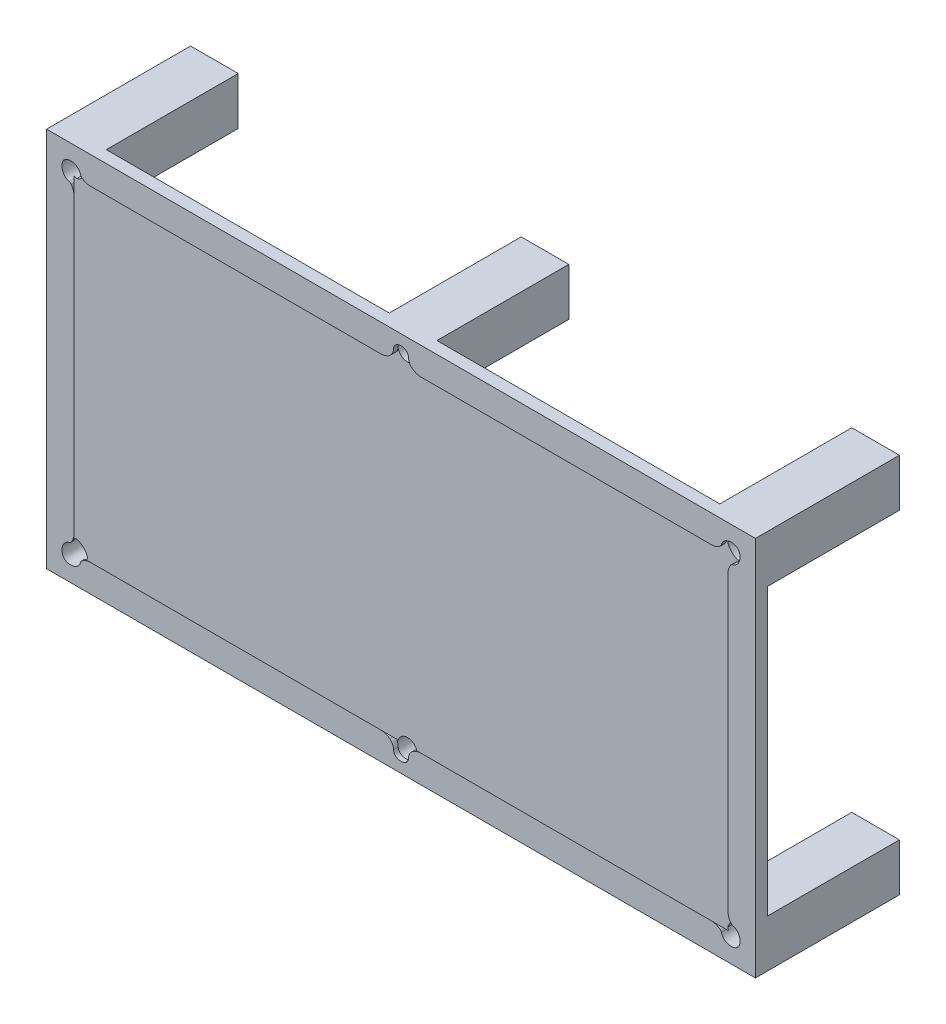
from build123d import *
from build123d.topology import SkipClean

# Parameters (mm, degrees)
SZKIC1_W                        = 3869
SZKIC1_H                        = 2078
SZKIC1_W_2                      = 3569
SZKIC1_H_2                      = 1778
DODANIE_WYCI_GNI_CIE1_DEPTH     = 36
SFAZOWANIE1_SIZE                = 36
SZKIC3_W                        = 3869
SZKIC3_H                        = 2078
DODANIE_WYCI_GNI_CIE3_DEPTH     = 30
SZKIC5_W                        = 260
SZKIC5_H                        = 260
DODANIE_WYCI_GNI_CIE4_DEPTH     = 720
WYTNIJ_WYCI_GNI_CIE1_DEPTH      = 35
WYTNIJ_WYCI_GNI_CIE2_START      = -652
WYTNIJ_WYCI_GNI_CIE2_DEPTH      = 652
ZAOKR_GLENIE1_R                 = 20
WYTNIJ_WYCI_GNI_CIE3_DEPTH      = 35
WYTNIJ_WYCI_GNI_CIE4_DEPTH      = 10
WYTNIJ_WYCI_GNI_CIE4_DEPTH_BACK = 594
SZKIC11_R                       = 53.19
WYTNIJ_WYCI_GNI_CIE5_DEPTH      = 511
DODANIE_WYCI_GNI_CIE5_START     = 720
DODANIE_WYCI_GNI_CIE5_DEPTH     = 720


# Read off the part's stored shape, not the designer's step: Wytnij-wyciągnięcie2
with BuildPart() as part:
    # Szkic1 → Dodanie-wyciągnięcie1 (new body)
    with BuildSketch(Plane.XY):
        Rectangle(SZKIC1_W, SZKIC1_H)
        Rectangle(SZKIC1_W_2, SZKIC1_H_2, mode=Mode.SUBTRACT)
    extrude(amount=DODANIE_WYCI_GNI_CIE1_DEPTH)

    # Sfazowanie1
    sfazowanie1_edges = [part.edges().sort_by_distance(p)[0] for p in [
        (-1784.5, 0, 0),
        (0, -889, 0),
        (1784.5, 0, 0),
        (0, 889, 0),
    ]]
    chamfer(sfazowanie1_edges, length=SFAZOWANIE1_SIZE - 0.0001)  # a hair under: the kernel refuses the full size

    # Szkic3 → Dodanie-wyciągnięcie3 (add)
    with BuildSketch(Plane(origin=(0, 0, 0), x_dir=(-1, 0, 0), z_dir=(0, 0, -1))):
        Rectangle(SZKIC3_W, SZKIC3_H)
    extrude(amount=DODANIE_WYCI_GNI_CIE3_DEPTH)

    # Szkic5 → Dodanie-wyciągnięcie4 (add)
    with BuildSketch(Plane(origin=(0, 0, -30), x_dir=(-1, 0, 0), z_dir=(0, 0, -1))):
        with Locations((-1804.5, 909)):
            Rectangle(SZKIC5_W, SZKIC5_H)
        with Locations((1804.5, 909)):
            Rectangle(SZKIC5_W, SZKIC5_H)
        with Locations((1804.5, -909)):
            Rectangle(SZKIC5_W, SZKIC5_H)
        with Locations((-1804.5, -909)):
            Rectangle(SZKIC5_W, SZKIC5_H)
    extrude(amount=DODANIE_WYCI_GNI_CIE4_DEPTH)

    # Szkic6 → Wytnij-wyciągnięcie1 (cut)
    with BuildSketch(Plane.XY.offset(36)):
        with BuildLine():
            Line((-1730.699930173, -898.305119808), (-1735.775702356, -889))
            Line((-1735.775702356, -889), (-1757.066073244, -889))
            ThreePointArc((-1757.066073244, -889), (-1751.617811819, -898.93387879), (-1747.477245282, -909.480025439))
            ThreePointArc((-1747.477245282, -909.480025439), (-1739.335219817, -903.522294393), (-1730.699930173, -898.305119808))
        make_face()
        with BuildLine():
            ThreePointArc((-1730.699930173, -898.305119808), (-1713.038835988, -891.362916259), (-1694.21, -889))
            Line((-1694.21, -889), (-1735.775702356, -889))
            Line((-1735.775702356, -889), (-1730.699930173, -898.305119808))
        make_face()
        with BuildLine():
            ThreePointArc((-1804.980025439, -851.977245282), (-1794.43387879, -856.117811819), (-1784.5, -861.566073244))
            Line((-1784.5, -861.566073244), (-1784.5, -840.275702356))
            Line((-1784.5, -840.275702356), (-1793.805119808, -835.199930173))
            ThreePointArc((-1793.805119808, -835.199930173), (-1799.022294393, -843.835219817), (-1804.980025439, -851.977245282))
        make_face()
        with BuildLine():
            Line((-1793.805119808, -835.199930173), (-1784.5, -840.275702356))
            Line((-1784.5, -840.275702356), (-1784.5, -798.71))
            ThreePointArc((-1784.5, -798.71), (-1786.862916259, -817.538835988), (-1793.805119808, -835.199930173))
        make_face()
        with BuildLine():
            ThreePointArc((-1747.477245282, 909.480025439), (-1751.617811819, 898.93387879), (-1757.066073244, 889))
            Line((-1757.066073244, 889), (-1735.775702356, 889))
            Line((-1735.775702356, 889), (-1730.699930173, 898.305119808))
            ThreePointArc((-1730.699930173, 898.305119808), (-1739.335219817, 903.522294393), (-1747.477245282, 909.480025439))
        make_face()
        with BuildLine():
            Line((-1730.699930173, 898.305119808), (-1735.775702356, 889))
            Line((-1735.775702356, 889), (-1694.21, 889))
            ThreePointArc((-1694.21, 889), (-1713.038835988, 891.362916259), (-1730.699930173, 898.305119808))
        make_face()
        with BuildLine():
            ThreePointArc((-1793.805119808, 835.199930173), (-1786.862916259, 817.538835988), (-1784.5, 798.71))
            Line((-1784.5, 798.71), (-1784.5, 840.275702356))
            Line((-1784.5, 840.275702356), (-1793.805119808, 835.199930173))
        make_face()
        with BuildLine():
            Line((-1793.805119808, 835.199930173), (-1784.5, 840.275702356))
            Line((-1784.5, 840.275702356), (-1784.5, 861.566073244))
            ThreePointArc((-1784.5, 861.566073244), (-1794.43387879, 856.117811819), (-1804.980025439, 851.977245282))
            ThreePointArc((-1804.980025439, 851.977245282), (-1799.022294393, 843.835219817), (-1793.805119808, 835.199930173))
        make_face()
        with BuildLine():
            Line((1694.21, 889), (1735.775702356, 889))
            Line((1735.775702356, 889), (1730.699930173, 898.305119808))
            ThreePointArc((1730.699930173, 898.305119808), (1713.038835988, 891.362916259), (1694.21, 889))
        make_face()
        with BuildLine():
            Line((1735.775702356, 889), (1757.066073244, 889))
            ThreePointArc((1757.066073244, 889), (1751.617811819, 898.93387879), (1747.477245282, 909.480025439))
            ThreePointArc((1747.477245282, 909.480025439), (1739.335219817, 903.522294393), (1730.699930173, 898.305119808))
            Line((1730.699930173, 898.305119808), (1735.775702356, 889))
        make_face()
        with BuildLine():
            Line((1784.5, 861.566073244), (1784.5, 840.275702356))
            Line((1784.5, 840.275702356), (1793.805119808, 835.199930173))
            ThreePointArc((1793.805119808, 835.199930173), (1799.022294393, 843.835219817), (1804.980025439, 851.977245282))
            ThreePointArc((1804.980025439, 851.977245282), (1794.43387879, 856.117811819), (1784.5, 861.566073244))
        make_face()
        with BuildLine():
            Line((1784.5, 840.275702356), (1784.5, 798.71))
            ThreePointArc((1784.5, 798.71), (1786.862916259, 817.538835988), (1793.805119808, 835.199930173))
            Line((1793.805119808, 835.199930173), (1784.5, 840.275702356))
        make_face()
        with BuildLine():
            Line((1735.775702356, -889), (1694.21, -889))
            ThreePointArc((1694.21, -889), (1713.038835988, -891.362916259), (1730.699930173, -898.305119808))
            Line((1730.699930173, -898.305119808), (1735.775702356, -889))
        make_face()
        with BuildLine():
            Line((1757.066073244, -889), (1735.775702356, -889))
            Line((1735.775702356, -889), (1730.699930173, -898.305119808))
            ThreePointArc((1730.699930173, -898.305119808), (1739.335219817, -903.522294393), (1747.477245282, -909.480025439))
            ThreePointArc((1747.477245282, -909.480025439), (1751.617811819, -898.93387879), (1757.066073244, -889))
        make_face()
        with BuildLine():
            Line((1784.5, -840.275702356), (1784.5, -861.566073244))
            ThreePointArc((1784.5, -861.566073244), (1794.43387879, -856.117811819), (1804.980025439, -851.977245282))
            ThreePointArc((1804.980025439, -851.977245282), (1799.022294393, -843.835219817), (1793.805119808, -835.199930173))
            Line((1793.805119808, -835.199930173), (1784.5, -840.275702356))
        make_face()
        with BuildLine():
            Line((1784.5, -798.71), (1784.5, -840.275702356))
            Line((1784.5, -840.275702356), (1793.805119808, -835.199930173))
            ThreePointArc((1793.805119808, -835.199930173), (1786.862916259, -817.538835988), (1784.5, -798.71))
        make_face()
    extrude(amount=-WYTNIJ_WYCI_GNI_CIE1_DEPTH, mode=Mode.SUBTRACT)

    # Wytnij-wyciągnięcie2 outline → Wytnij-wyciągnięcie2 (cut)
    with BuildSketch(Plane.XY.offset(36).offset(WYTNIJ_WYCI_GNI_CIE2_START)):
        with BuildLine():
            add(Edge.make_bspline(
                [(-1804.980025439, 851.977245282), (-1851.807541301, 858.242170001), (-1873.141506019, 977.641506019), (-1753.742170001, 956.307541301), (-1747.477245282, 909.480025439)],
                knots=[0, 0, 0, 0, 0.5, 1, 1, 1, 1], degree=3))
            ThreePointArc((-1804.980025439, 851.977245282), (-1794.43387879, 856.117811819), (-1784.5, 861.566073244))
            add(Edge.make_bspline(
                [(-1784.5, 861.566073244), (-1773.547324001, 868.583765228), (-1764.083765228, 878.047324001), (-1757.066073244, 889)],
                knots=[0.269130869, 0.269130869, 0.269130869, 0.269130869, 0.730869131, 0.730869131, 0.730869131, 0.730869131], degree=3))
            ThreePointArc((-1757.066073244, 889), (-1751.617811819, 898.93387879), (-1747.477245282, 909.480025439))
        make_face()
        with BuildLine():
            add(Edge.make_bspline(
                [(-1804.980025439, -851.977245282), (-1851.807541301, -858.242170001), (-1873.141506019, -977.641506019), (-1753.742170001, -956.307541301), (-1747.477245282, -909.480025439)],
                knots=[0, 0, 0, 0, 0.5, 1, 1, 1, 1], degree=3))
            add(Edge.make_bspline(
                [(-1747.477245282, -909.480025439), (-1755.796755668, -882.703934402), (-1778.203934402, -860.296755668), (-1804.980025439, -851.977245282)],
                knots=[0.730869131, 0.730869131, 0.730869131, 0.730869131, 1.730869131, 1.730869131, 1.730869131, 1.730869131], degree=3))
        make_face()
        with BuildLine():
            add(Edge.make_bspline(
                [(1804.980025439, -851.977245282), (1851.807541301, -858.242170001), (1873.141506019, -977.641506019), (1753.742170001, -956.307541301), (1747.477245282, -909.480025439)],
                knots=[0, 0, 0, 0, 0.5, 1, 1, 1, 1], degree=3))
            ThreePointArc((1804.980025439, -851.977245282), (1794.43387879, -856.117811819), (1784.5, -861.566073244))
            add(Edge.make_bspline(
                [(1784.5, -861.566073244), (1773.547324001, -868.583765228), (1764.083765228, -878.047324001), (1757.066073244, -889)],
                knots=[0.269130869, 0.269130869, 0.269130869, 0.269130869, 0.730869131, 0.730869131, 0.730869131, 0.730869131], degree=3))
            ThreePointArc((1757.066073244, -889), (1751.617811819, -898.93387879), (1747.477245282, -909.480025439))
        make_face()
        with BuildLine():
            add(Edge.make_bspline(
                [(1804.980025439, 851.977245282), (1851.807541301, 858.242170001), (1873.141506019, 977.641506019), (1753.742170001, 956.307541301), (1747.477245282, 909.480025439)],
                knots=[0, 0, 0, 0, 0.5, 1, 1, 1, 1], degree=3))
            add(Edge.make_bspline(
                [(1747.477245282, 909.480025439), (1755.796755668, 882.703934402), (1778.203934402, 860.296755668), (1804.980025439, 851.977245282)],
                knots=[0.730869131, 0.730869131, 0.730869131, 0.730869131, 1.730869131, 1.730869131, 1.730869131, 1.730869131], degree=3))
        make_face()
    extrude(amount=WYTNIJ_WYCI_GNI_CIE2_DEPTH, mode=Mode.SUBTRACT)

    # Zaokrąglenie1
    zaokr_glenie1_edges = [part.edges().sort_by_distance(p)[0] for p in [
        (-1804.980025439, 851.977245282, 25.75993728),
        (-1747.477245282, 909.480025439, 25.75993728),
        (-1804.980025439, -851.977245282, 25.75993728),
        (-1747.477245282, -909.480025439, 25.75993728),
        (1747.477245282, -909.480025439, 25.75993728),
        (1804.980025439, -851.977245282, 25.75993728),
        (1804.980025439, 851.977245282, 25.75993728),
        (1747.477245282, 909.480025439, 25.75993728),
    ]]
    fillet(zaokr_glenie1_edges, radius=ZAOKR_GLENIE1_R)

    # Szkic8 → Wytnij-wyciągnięcie3 (cut)
    with BuildSketch(Plane.XY.offset(36)):
        with BuildLine():
            ThreePointArc((-43.031613931, -909.545702431), (-29.388461869, -896.476103161), (-12.037441589, -889))
            Line((-12.037441589, -889), (-110.34, -889))
            ThreePointArc((-110.34, -889), (-84.719347685, -893.241564094), (-61.832573079, -905.513655976))
            ThreePointArc((-61.832573079, -905.513655976), (-55.109242933, -911.672624899), (-49.53, -918.884290086))
            Line((-49.53, -918.884290086), (-43.031613931, -909.545702431))
        make_face()
        with BuildLine():
            Line((0, -940.81), (0, -889))
            Line((0, -889), (-12.037441589, -889))
            ThreePointArc((-12.037441589, -889), (-29.388461869, -896.476103161), (-43.031613931, -909.545702431))
            Line((-43.031613931, -909.545702431), (0, -940.81))
        make_face()
        with BuildLine():
            ThreePointArc((43.031613931, -909.545702431), (29.388461869, -896.476103161), (12.037441589, -889))
            Line((12.037441589, -889), (0, -889))
            Line((0, -889), (0, -940.81))
            Line((0, -940.81), (43.031613931, -909.545702431))
        make_face()
        with BuildLine():
            ThreePointArc((61.832573079, -905.513655976), (84.719347685, -893.241564094), (110.34, -889))
            Line((110.34, -889), (12.037441589, -889))
            ThreePointArc((12.037441589, -889), (29.388461869, -896.476103161), (43.031613931, -909.545702431))
            Line((43.031613931, -909.545702431), (49.53, -918.884290086))
            ThreePointArc((49.53, -918.884290086), (55.109242933, -911.672624899), (61.832573079, -905.513655976))
        make_face()
        with BuildLine():
            Line((49.53, -918.884290086), (43.031613931, -909.545702431))
            Line((43.031613931, -909.545702431), (0, -940.81))
            Line((0, -940.81), (-43.031613931, -909.545702431))
            Line((-43.031613931, -909.545702431), (-49.53, -918.884290086))
            ThreePointArc((-49.53, -918.884290086), (-43.166542194, -932.765858286), (-40.986117651, -947.88))
            Line((-40.986117651, -947.88), (40.986117651, -947.88))
            ThreePointArc((40.986117651, -947.88), (43.166542194, -932.765858286), (49.53, -918.884290086))
        make_face()
        with BuildLine():
            Line((-110.34, 889), (-12.037441589, 889))
            ThreePointArc((-12.037441589, 889), (-29.388461869, 896.476103161), (-43.031613931, 909.545702431))
            Line((-43.031613931, 909.545702431), (-49.53, 918.884290086))
            ThreePointArc((-49.53, 918.884290086), (-55.109242933, 911.672624899), (-61.832573079, 905.513655976))
            ThreePointArc((-61.832573079, 905.513655976), (-84.719347685, 893.241564094), (-110.34, 889))
        make_face()
        with BuildLine():
            Line((0, 940.81), (43.031613931, 909.545702431))
            Line((43.031613931, 909.545702431), (49.53, 918.884290086))
            ThreePointArc((49.53, 918.884290086), (43.166542194, 932.765858286), (40.986117651, 947.88))
            Line((40.986117651, 947.88), (-40.986117651, 947.88))
            ThreePointArc((-40.986117651, 947.88), (-43.166542194, 932.765858286), (-49.53, 918.884290086))
            Line((-49.53, 918.884290086), (-43.031613931, 909.545702431))
            Line((-43.031613931, 909.545702431), (0, 940.81))
        make_face()
        with BuildLine():
            Line((-12.037441589, 889), (0, 889))
            Line((0, 889), (0, 940.81))
            Line((0, 940.81), (-43.031613931, 909.545702431))
            ThreePointArc((-43.031613931, 909.545702431), (-29.388461869, 896.476103161), (-12.037441589, 889))
        make_face()
        with BuildLine():
            Line((0, 889), (12.037441589, 889))
            ThreePointArc((12.037441589, 889), (29.388461869, 896.476103161), (43.031613931, 909.545702431))
            Line((43.031613931, 909.545702431), (0, 940.81))
            Line((0, 940.81), (0, 889))
        make_face()
        with BuildLine():
            Line((12.037441589, 889), (110.34, 889))
            ThreePointArc((110.34, 889), (84.719347685, 893.241564094), (61.832573079, 905.513655976))
            ThreePointArc((61.832573079, 905.513655976), (55.109242933, 911.672624899), (49.53, 918.884290086))
            Line((49.53, 918.884290086), (43.031613931, 909.545702431))
            ThreePointArc((43.031613931, 909.545702431), (29.388461869, 896.476103161), (12.037441589, 889))
        make_face()
    extrude(amount=-WYTNIJ_WYCI_GNI_CIE3_DEPTH, mode=Mode.SUBTRACT)

    # Szkic11 → Wytnij-wyciągnięcie4 (cut, two sides: drawn at the far end of the back side and taken through both)
    with BuildSketch(Plane.XY.offset(-WYTNIJ_WYCI_GNI_CIE4_DEPTH_BACK)):
        with Locations(Location((0, -940.81, 0), (0, 0, 162.70831437))):
            Circle(SZKIC11_R)
        with Locations(Location((0, 940.81, 0), (0, 0, 197.29168563))):
            Circle(SZKIC11_R)
    extrude(amount=WYTNIJ_WYCI_GNI_CIE4_DEPTH + WYTNIJ_WYCI_GNI_CIE4_DEPTH_BACK, mode=Mode.SUBTRACT)

    # Szkic12 → Wytnij-wyciągnięcie5 (cut)
    with BuildSketch(Plane.XY.offset(36)):
        with BuildLine():
            add(Edge.make_bspline(
                [(-40.986117651, 947.88), (-40.011349902, 962.578981992), (-31.594207563, 972.578981992), (-20.493058826, 977.88)],
                knots=[0, 0, 0, 0, 0.319680778, 0.319680778, 0.319680778, 0.319680778], degree=3))
            Line((-40.986117651, 947.88), (-20.493058826, 947.88))
            Line((-20.493058826, 947.88), (-20.493058826, 977.88))
        make_face()
        with BuildLine():
            Line((-20.493058826, 977.88), (-20.493058826, 947.88))
            Line((-20.493058826, 947.88), (0, 947.88))
            Line((0, 947.88), (20.493058826, 947.88))
            Line((20.493058826, 947.88), (20.493058826, 977.88))
            add(Edge.make_bspline(
                [(-20.493058826, 977.88), (-7.969625141, 983.860187191), (7.969625141, 983.860187191), (20.493058826, 977.88)],
                knots=[0.319680778, 0.319680778, 0.319680778, 0.319680778, 0.680319222, 0.680319222, 0.680319222, 0.680319222], degree=3))
        make_face()
        with BuildLine():
            add(Edge.make_bspline(
                [(20.493058826, 977.88), (31.594207563, 972.578981992), (40.011349902, 962.578981992), (40.986117651, 947.88)],
                knots=[0.680319222, 0.680319222, 0.680319222, 0.680319222, 1, 1, 1, 1], degree=3))
            Line((20.493058826, 977.88), (20.493058826, 947.88))
            Line((20.493058826, 947.88), (40.986117651, 947.88))
        make_face()
        with BuildLine():
            add(Edge.make_bspline(
                [(-40.986117651, -947.88), (-40.011349902, -962.578981992), (-31.594207563, -972.578981992), (-20.493058826, -977.88)],
                knots=[0, 0, 0, 0, 0.319680778, 0.319680778, 0.319680778, 0.319680778], degree=3))
            Line((-20.493058826, -977.88), (-20.493058826, -947.88))
            Line((-20.493058826, -947.88), (-40.986117651, -947.88))
        make_face()
        with BuildLine():
            Line((20.493058826, -977.88), (20.493058826, -947.88))
            Line((20.493058826, -947.88), (0, -947.88))
            Line((0, -947.88), (-20.493058826, -947.88))
            Line((-20.493058826, -947.88), (-20.493058826, -977.88))
            add(Edge.make_bspline(
                [(-20.493058826, -977.88), (-7.969625141, -983.860187191), (7.969625141, -983.860187191), (20.493058826, -977.88)],
                knots=[0.319680778, 0.319680778, 0.319680778, 0.319680778, 0.680319222, 0.680319222, 0.680319222, 0.680319222], degree=3))
        make_face()
        with BuildLine():
            Line((40.986117651, -947.88), (20.493058826, -947.88))
            Line((20.493058826, -947.88), (20.493058826, -977.88))
            add(Edge.make_bspline(
                [(20.493058826, -977.88), (31.594207563, -972.578981992), (40.011349902, -962.578981992), (40.986117651, -947.88)],
                knots=[0.680319222, 0.680319222, 0.680319222, 0.680319222, 1, 1, 1, 1], degree=3))
        make_face()
    extrude(amount=-WYTNIJ_WYCI_GNI_CIE5_DEPTH, mode=Mode.SUBTRACT)

    # Szkic13 → Dodanie-wyciągnięcie5 (add)
    # profile 1 of 2: a face of its own
    with SkipClean():  # the faces are left unmerged after this step: merging them gives an invalid solid
        with BuildSketch(Plane(origin=(0, 0, -30), x_dir=(-1, 0, 0), z_dir=(0, 0, -1)).offset(DODANIE_WYCI_GNI_CIE5_START)):
            Polygon((130, 1039), (0, 1039), (-130, 1039), (-130, 779), (130, 779), align=None)
            with BuildLine():
                ThreePointArc((53.19, 940.81), (-37.611009691, 903.198990309), (0, 994))
                ThreePointArc((0, 994), (37.611009691, 978.421009691), (53.19, 940.81))
            make_face(mode=Mode.SUBTRACT)
        # profile 2 of 2: a face of its own
        with BuildSketch(Plane(origin=(0, 0, -30), x_dir=(-1, 0, 0), z_dir=(0, 0, -1)).offset(DODANIE_WYCI_GNI_CIE5_START)):
            Polygon((-130, -779), (-130, -1039), (0, -1039), (130, -1039), (130, -779), align=None)
            with BuildLine():
                ThreePointArc((53.19, -940.81), (37.611009691, -978.421009691), (0, -994))
                ThreePointArc((0, -994), (-37.611009691, -903.198990309), (53.19, -940.81))
            make_face(mode=Mode.SUBTRACT)
        extrude(amount=-DODANIE_WYCI_GNI_CIE5_DEPTH)


solid = part.part
